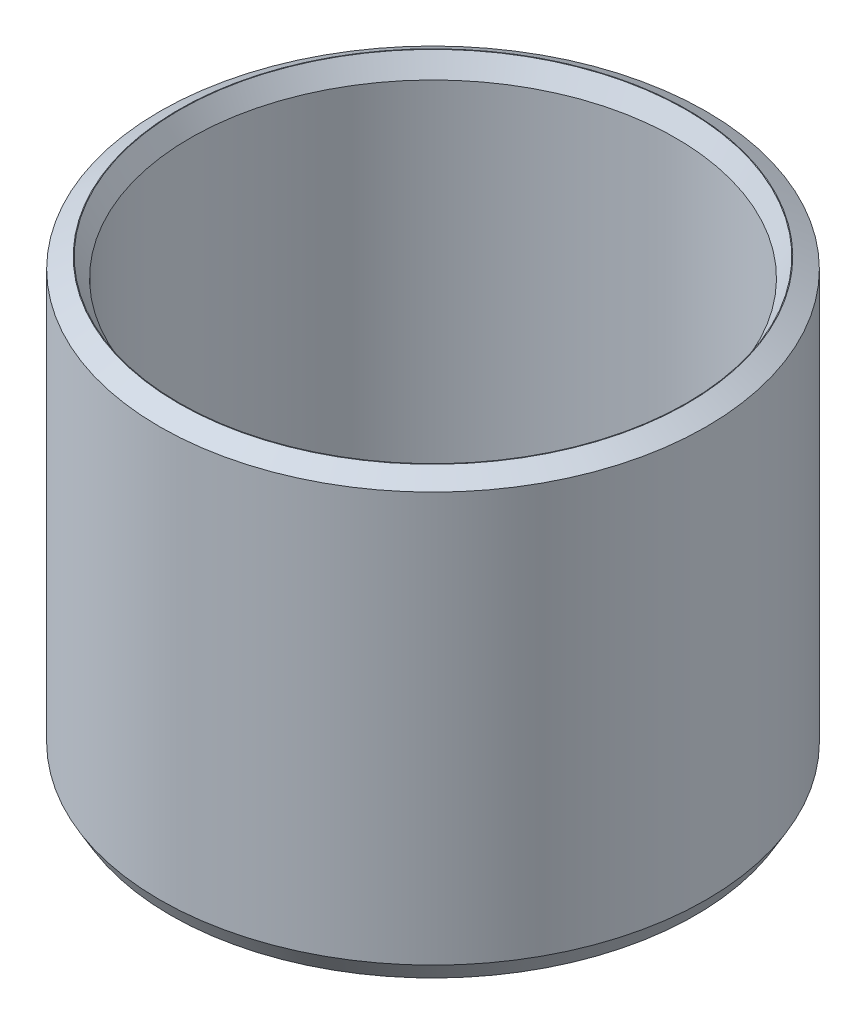
from build123d import *
from OCP.BRepFilletAPI import BRepFilletAPI_MakeChamfer

# Parameters (mm, degrees)
SKETCH1_R           = 40
BOSS_EXTRUDE1_DEPTH = 64.318342388
SKETCH2_R           = 35.558863798
CUT_EXTRUDE1_DEPTH  = 86.655409447
CHAMFER1_SIZE       = 1.589406536
CHAMFER1_SIZE2      = 2.752932874


with BuildPart() as part:
    # Sketch1 → Boss-Extrude1 (new body)
    with BuildSketch(Plane(origin=(0, 0, 0), x_dir=(1, 0, 0), z_dir=(0, 1, 0))):
        Circle(SKETCH1_R)
    extrude(amount=BOSS_EXTRUDE1_DEPTH)

    # Sketch2 → Cut-Extrude1 (cut, through all)
    with BuildSketch(Plane(origin=(0, 0, 0), x_dir=(1, 0, 0), z_dir=(0, 1, 0))):
        Circle(SKETCH2_R)
    extrude(amount=CUT_EXTRUDE1_DEPTH, mode=Mode.SUBTRACT)

    # Chamfer1: one chamfer whose edges measure the first distance from different faces: ONE call of the kernel's chamfer builder (chamfer() names one face for all edges)
    chamfer1_edges_1 = [part.edges().sort_by_distance(p)[0] for p in [
        (-35.558863798, 64.318342388, 0),
    ]]
    chamfer1_side_1 = [part.faces().sort_by_distance(p)[0] for p in [
        (-38.86862915, 64.318342388, 0),
    ]]
    chamfer1_edges_2 = [part.edges().sort_by_distance(p)[0] for p in [
        (-35.558863798, 0, 0),
    ]]
    chamfer1_side_2 = [part.faces().sort_by_distance(p)[0] for p in [
        (-35.558863798, 32.159171194, 0),
    ]]
    chamfer1_edges_3 = [part.edges().sort_by_distance(p)[0] for p in [
        (-40, 0, 0),
    ]]
    chamfer1_side_3 = [part.faces().sort_by_distance(p)[0] for p in [
        (-38.86862915, 0, 0),
    ]]
    chamfer1_edges_4 = [part.edges().sort_by_distance(p)[0] for p in [
        (-40, 64.318342388, 0),
    ]]
    chamfer1_side_4 = [part.faces().sort_by_distance(p)[0] for p in [
        (-40, 32.159171194, 0),
    ]]
    chamfer1 = BRepFilletAPI_MakeChamfer(part.part.solid().wrapped)
    for e in chamfer1_edges_1:
        chamfer1.Add(CHAMFER1_SIZE, CHAMFER1_SIZE2, e.wrapped, chamfer1_side_1[0].wrapped)  # the first distance lies on this face
    for e in chamfer1_edges_2:
        chamfer1.Add(CHAMFER1_SIZE, CHAMFER1_SIZE2, e.wrapped, chamfer1_side_2[0].wrapped)  # the first distance lies on this face
    for e in chamfer1_edges_3:
        chamfer1.Add(CHAMFER1_SIZE, CHAMFER1_SIZE2, e.wrapped, chamfer1_side_3[0].wrapped)  # the first distance lies on this face
    for e in chamfer1_edges_4:
        chamfer1.Add(CHAMFER1_SIZE, CHAMFER1_SIZE2, e.wrapped, chamfer1_side_4[0].wrapped)  # the first distance lies on this face
    add(Compound.cast(chamfer1.Shape()), mode=Mode.REPLACE)


solid = part.part
